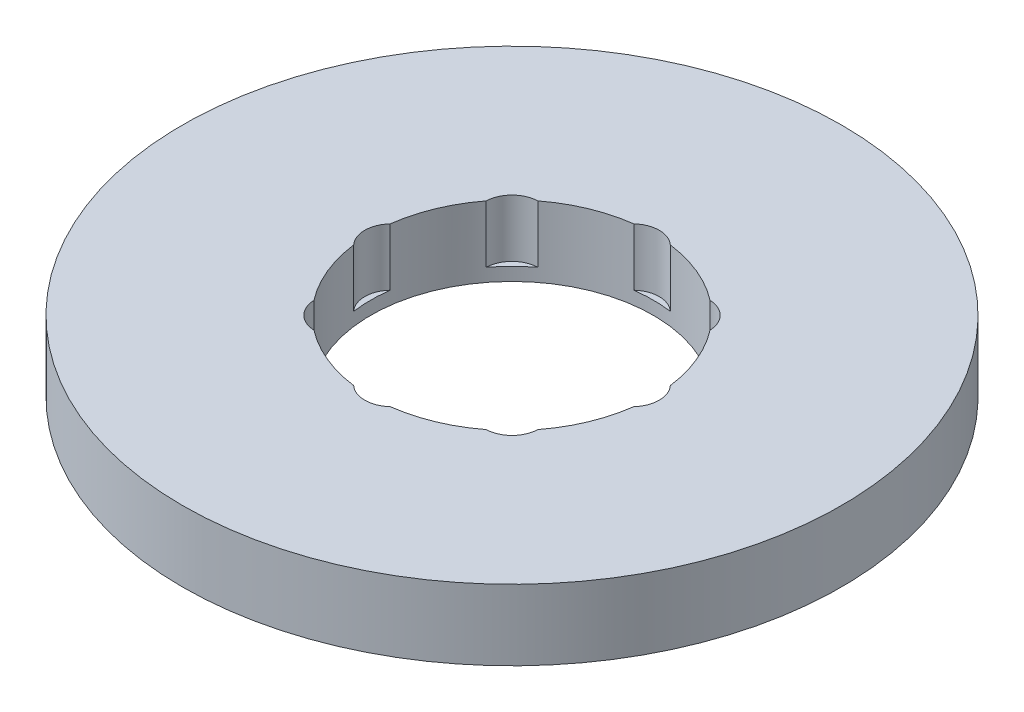
from build123d import *

# Parameters (mm, degrees)
SKETCH1_R           = 70
BOSS_EXTRUDE1_DEPTH = 15
SKETCH2_R           = 30
CUT_EXTRUDE1_DEPTH  = 101.124921973
SKETCH3_R           = 5.705285386
CUT_EXTRUDE2_DEPTH  = 12.207222938
CIRPATTERN1_COUNT   = 8


with BuildPart() as part:
    # Sketch1 → Boss-Extrude1 (new body)
    with BuildSketch(Plane(origin=(0, 0, 0), x_dir=(1, 0, 0), z_dir=(0, 1, 0))):
        Circle(SKETCH1_R)
    extrude(amount=BOSS_EXTRUDE1_DEPTH)

    # Sketch2 → Cut-Extrude1 (cut, through all)
    with BuildSketch(Plane(origin=(0, 0, 0), x_dir=(1, 0, 0), z_dir=(0, 1, 0))):
        Circle(SKETCH2_R)
    extrude(amount=CUT_EXTRUDE1_DEPTH, mode=Mode.SUBTRACT)

    # Sketch3 → Cut-Extrude2 (cut)
    with BuildSketch(Plane(origin=(0, 15, 0), x_dir=(1, 0, 0), z_dir=(0, 1, 0))):
        with Locations((-25.564960321, 0)):
            Circle(SKETCH3_R)
    cut_extrude2 = extrude(amount=-CUT_EXTRUDE2_DEPTH, mode=Mode.SUBTRACT)

    # CirPattern1: Cut-Extrude2 ×8 about axis
    cirpattern1_axis = Axis((0, 0, 0), (0, 1, 0))
    for i in range(1, CIRPATTERN1_COUNT):
        add(cut_extrude2.rotate(cirpattern1_axis, i * 360 / CIRPATTERN1_COUNT), mode=Mode.SUBTRACT)


solid = part.part
